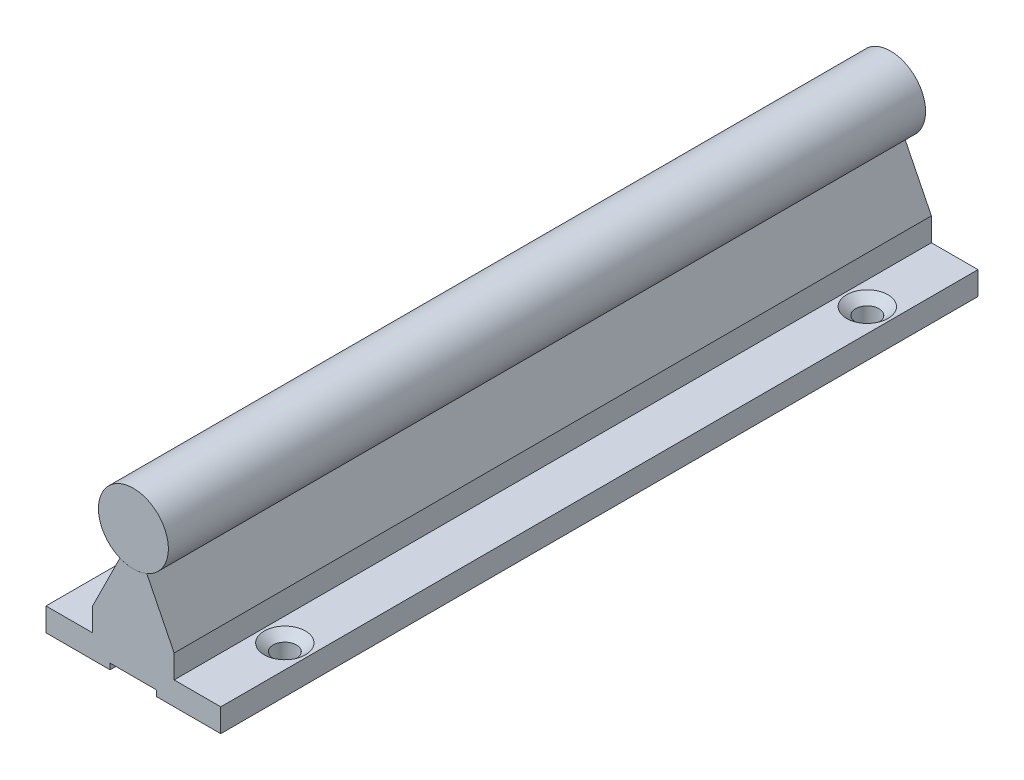
from build123d import *

# Parameters (mm, degrees)
RAILBASE_DEPTH     = 750
SKETCH3_R          = 6
RAIL_DEPTH         = 750
CUT_EXTRUDE1_START = -4
SKETCH4_R          = 2
CUT_EXTRUDE1_DEPTH = 4
SKETCH11_W         = 30
SKETCH11_H         = 324.866250412
SKETCH11_H_2       = 295.133749588
CUT_EXTRUDE2_DEPTH = 86


# Read off the part's stored shape, not the designer's step: AdvancedHole5
with BuildPart() as part:
    # Sketch2 → RailBase (new body)
    with BuildSketch(Plane.XY):
        with BuildLine():
            Line((7, -14.5), (15, -14.5))
            Line((15, -14.5), (15, -10.5))
            Line((15, -10.5), (7, -10.5))
            Line((7, -10.5), (7, -6.5))
            Line((7, -6.5), (2.30401202, 2.960006443))
            ThreePointArc((2.30401202, 2.960006443), (0, 2.5), (-2.30401202, 2.960006443))
            Line((-2.30401202, 2.960006443), (-7, -6.5))
            Line((-7, -6.5), (-7, -10.5))
            Line((-7, -10.5), (-15, -10.5))
            Line((-15, -10.5), (-15, -14.5))
            Line((-15, -14.5), (-7, -14.5))
            Line((-7, -14.5), (-4, -14.5))
            Line((-4, -14.5), (-4, -13.5))
            Line((-4, -13.5), (4, -13.5))
            Line((4, -13.5), (4, -14.5))
            Line((4, -14.5), (7, -14.5))
        make_face()
    extrude(amount=RAILBASE_DEPTH)

    # Sketch4 → Cut-Extrude1 (cut)
    with BuildSketch(Plane(origin=(0, -10.5, 0), x_dir=(1, 0, 0), z_dir=(0, 1, 0)).offset(CUT_EXTRUDE1_START)):
        with Locations(Location((11, -739.866250412, 0), (0, 0, 270))):
            Circle(SKETCH4_R)
        with Locations(Location((-11, -739.866250412, 0), (0, 0, 270))):
            Circle(SKETCH4_R)
        with Locations(Location((-11, -639.866250412, 0), (0, 0, 270))):
            Circle(SKETCH4_R)
        with Locations(Location((-11, -539.866250412, 0), (0, 0, 270))):
            Circle(SKETCH4_R)
        with Locations(Location((-11, -439.866250412, 0), (0, 0, 270))):
            Circle(SKETCH4_R)
        with Locations(Location((-11, -339.866250412, 0), (0, 0, 270))):
            Circle(SKETCH4_R)
        with Locations(Location((-11, -239.866250412, 0), (0, 0, 270))):
            Circle(SKETCH4_R)
        with Locations(Location((-11, -139.866250412, 0), (0, 0, 270))):
            Circle(SKETCH4_R)
        with Locations(Location((-11, -39.866250412, 0), (0, 0, 270))):
            Circle(SKETCH4_R)
        with Locations(Location((11, -639.866250412, 0), (0, 0, 270))):
            Circle(SKETCH4_R)
        with Locations(Location((11, -539.866250412, 0), (0, 0, 270))):
            Circle(SKETCH4_R)
        with Locations(Location((11, -439.866250412, 0), (0, 0, 270))):
            Circle(SKETCH4_R)
        with Locations(Location((11, -339.866250412, 0), (0, 0, 270))):
            Circle(SKETCH4_R)
        with Locations(Location((11, -239.866250412, 0), (0, 0, 270))):
            Circle(SKETCH4_R)
        with Locations(Location((11, -139.866250412, 0), (0, 0, 270))):
            Circle(SKETCH4_R)
        with Locations(Location((11, -39.866250412, 0), (0, 0, 270))):
            Circle(SKETCH4_R)
    extrude(amount=CUT_EXTRUDE1_DEPTH, mode=Mode.SUBTRACT)

    # AdvancedHole5 outline → AdvancedHole5 (revolve, cut)
    with BuildSketch(Plane(origin=(-11, 0, 39.866250412), x_dir=(1, 0, 0), z_dir=(0, 0, 1))):
        Polygon((2, -10.5), (2, -11.794982461), (3.5433, -10.5), align=None)
    revolve(axis=Axis((-11, 0, 39.866250412), (0, 1, 0)), mode=Mode.SUBTRACT)

    # AdvancedHole5 2 outline → AdvancedHole5 2 (revolve, cut)
    with BuildSketch(Plane(origin=(11, 0, 39.866250412), x_dir=(1, 0, 0), z_dir=(0, 0, 1))):
        Polygon((2, -10.5), (2, -11.794982461), (3.5433, -10.5), align=None)
    revolve(axis=Axis((11, 0, 39.866250412), (0, 1, 0)), mode=Mode.SUBTRACT)

    # AdvancedHole5 3 outline → AdvancedHole5 3 (revolve, cut)
    with BuildSketch(Plane(origin=(-11, 0, 139.866250412), x_dir=(1, 0, 0), z_dir=(0, 0, 1))):
        Polygon((2, -10.5), (2, -11.794982461), (3.5433, -10.5), align=None)
    revolve(axis=Axis((-11, 0, 139.866250412), (0, 1, 0)), mode=Mode.SUBTRACT)

    # AdvancedHole5 4 outline → AdvancedHole5 4 (revolve, cut)
    with BuildSketch(Plane(origin=(11, 0, 139.866250412), x_dir=(1, 0, 0), z_dir=(0, 0, 1))):
        Polygon((2, -10.5), (2, -11.794982461), (3.5433, -10.5), align=None)
    revolve(axis=Axis((11, 0, 139.866250412), (0, 1, 0)), mode=Mode.SUBTRACT)

    # AdvancedHole5 5 outline → AdvancedHole5 5 (revolve, cut)
    with BuildSketch(Plane(origin=(-11, 0, 239.866250412), x_dir=(1, 0, 0), z_dir=(0, 0, 1))):
        Polygon((2, -10.5), (2, -11.794982461), (3.5433, -10.5), align=None)
    revolve(axis=Axis((-11, 0, 239.866250412), (0, 1, 0)), mode=Mode.SUBTRACT)

    # AdvancedHole5 6 outline → AdvancedHole5 6 (revolve, cut)
    with BuildSketch(Plane(origin=(11, 0, 239.866250412), x_dir=(1, 0, 0), z_dir=(0, 0, 1))):
        Polygon((2, -10.5), (2, -11.794982461), (3.5433, -10.5), align=None)
    revolve(axis=Axis((11, 0, 239.866250412), (0, 1, 0)), mode=Mode.SUBTRACT)

    # AdvancedHole5 7 outline → AdvancedHole5 7 (revolve, cut)
    with BuildSketch(Plane(origin=(11, 0, 339.866250412), x_dir=(1, 0, 0), z_dir=(0, 0, 1))):
        Polygon((2, -10.5), (2, -11.794982461), (3.5433, -10.5), align=None)
    revolve(axis=Axis((11, 0, 339.866250412), (0, 1, 0)), mode=Mode.SUBTRACT)

    # AdvancedHole5 8 outline → AdvancedHole5 8 (revolve, cut)
    with BuildSketch(Plane(origin=(-11, 0, 339.866250412), x_dir=(1, 0, 0), z_dir=(0, 0, 1))):
        Polygon((2, -10.5), (2, -11.794982461), (3.5433, -10.5), align=None)
    revolve(axis=Axis((-11, 0, 339.866250412), (0, 1, 0)), mode=Mode.SUBTRACT)

    # AdvancedHole5 9 outline → AdvancedHole5 9 (revolve, cut)
    with BuildSketch(Plane(origin=(11, 0, 439.866250412), x_dir=(1, 0, 0), z_dir=(0, 0, 1))):
        Polygon((2, -10.5), (2, -11.794982461), (3.5433, -10.5), align=None)
    revolve(axis=Axis((11, 0, 439.866250412), (0, 1, 0)), mode=Mode.SUBTRACT)

    # AdvancedHole5 10 outline → AdvancedHole5 10 (revolve, cut)
    with BuildSketch(Plane(origin=(-11, 0, 439.866250412), x_dir=(1, 0, 0), z_dir=(0, 0, 1))):
        Polygon((2, -10.5), (2, -11.794982461), (3.5433, -10.5), align=None)
    revolve(axis=Axis((-11, 0, 439.866250412), (0, 1, 0)), mode=Mode.SUBTRACT)

    # AdvancedHole5 11 outline → AdvancedHole5 11 (revolve, cut)
    with BuildSketch(Plane(origin=(-11, 0, 539.866250412), x_dir=(1, 0, 0), z_dir=(0, 0, 1))):
        Polygon((2, -10.5), (2, -11.794982461), (3.5433, -10.5), align=None)
    revolve(axis=Axis((-11, 0, 539.866250412), (0, 1, 0)), mode=Mode.SUBTRACT)

    # AdvancedHole5 12 outline → AdvancedHole5 12 (revolve, cut)
    with BuildSketch(Plane(origin=(11, 0, 539.866250412), x_dir=(1, 0, 0), z_dir=(0, 0, 1))):
        Polygon((2, -10.5), (2, -11.794982461), (3.5433, -10.5), align=None)
    revolve(axis=Axis((11, 0, 539.866250412), (0, 1, 0)), mode=Mode.SUBTRACT)

    # AdvancedHole5 13 outline → AdvancedHole5 13 (revolve, cut)
    with BuildSketch(Plane(origin=(-11, 0, 639.866250412), x_dir=(1, 0, 0), z_dir=(0, 0, 1))):
        Polygon((2, -10.5), (2, -11.794982461), (3.5433, -10.5), align=None)
    revolve(axis=Axis((-11, 0, 639.866250412), (0, 1, 0)), mode=Mode.SUBTRACT)

    # AdvancedHole5 14 outline → AdvancedHole5 14 (revolve, cut)
    with BuildSketch(Plane(origin=(11, 0, 639.866250412), x_dir=(1, 0, 0), z_dir=(0, 0, 1))):
        Polygon((2, -10.5), (2, -11.794982461), (3.5433, -10.5), align=None)
    revolve(axis=Axis((11, 0, 639.866250412), (0, 1, 0)), mode=Mode.SUBTRACT)

    # AdvancedHole5 15 outline → AdvancedHole5 15 (revolve, cut)
    with BuildSketch(Plane(origin=(11, 0, 739.866250412), x_dir=(1, 0, 0), z_dir=(0, 0, 1))):
        Polygon((2, -10.5), (2, -11.794982461), (3.5433, -10.5), align=None)
    revolve(axis=Axis((11, 0, 739.866250412), (0, 1, 0)), mode=Mode.SUBTRACT)

    # AdvancedHole5 16 outline → AdvancedHole5 16 (revolve, cut)
    with BuildSketch(Plane(origin=(-11, 0, 739.866250412), x_dir=(1, 0, 0), z_dir=(0, 0, 1))):
        Polygon((2, -10.5), (2, -11.794982461), (3.5433, -10.5), align=None)
    revolve(axis=Axis((-11, 0, 739.866250412), (0, 1, 0)), mode=Mode.SUBTRACT)


with BuildPart() as body_2:
    # Sketch3 → Rail (new body)
    with BuildSketch(Plane.XY):
        with Locations((0, 8.5)):
            Circle(SKETCH3_R)
    extrude(amount=RAIL_DEPTH)


with BuildPart() as cut_extrude2_tool:
    # Sketch11 → Cut-Extrude2 (new body)
    with BuildSketch(Plane.XZ.offset(14.5)):
        with Locations((0, 162.433125206)):
            Rectangle(SKETCH11_W, SKETCH11_H)
        with Locations((0, 602.433125206)):
            Rectangle(SKETCH11_W, SKETCH11_H_2)
    extrude(amount=-CUT_EXTRUDE2_DEPTH)


with BuildPart() as part_1:
    add(part.part)

    # Cut-Extrude2: cut by cut_extrude2_tool
    add(cut_extrude2_tool.part, mode=Mode.SUBTRACT)


with BuildPart() as body_2_1:
    add(body_2.part)

    # Cut-Extrude2: cut by cut_extrude2_tool
    add(cut_extrude2_tool.part, mode=Mode.SUBTRACT)


solid = Compound([part_1.part, body_2_1.part])
